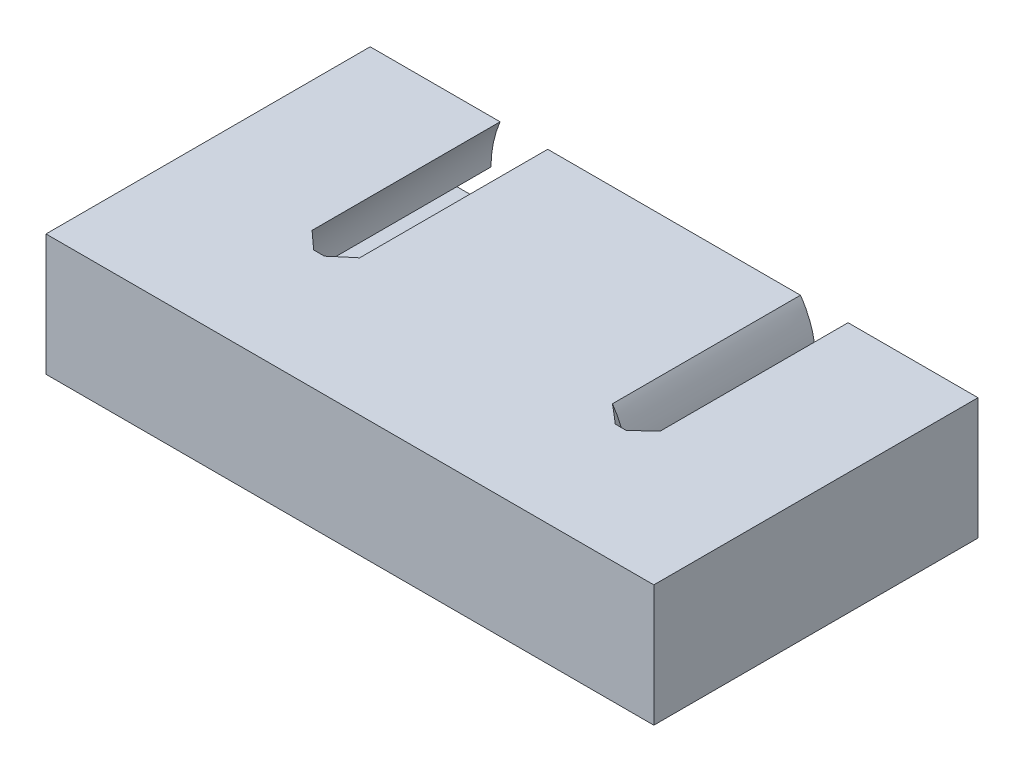
from build123d import *

# Parameters (mm, degrees)
BOSS_EXTRUDE1_DEPTH      = 7.5
BOSS_EXTRUDE1_DEPTH_BACK = 7.5
SKETCH1_W                = 75
SKETCH1_H                = 40
CUT_EXTRUDE1_DEPTH       = 5.2
CUT_EXTRUDE1_DEPTH_BACK  = 20
CHAMFER1_SIZE            = 2
SKETCH3_R                = 2
CUT_EXTRUDE2_DEPTH       = 9
CUT_EXTRUDE3_DEPTH       = 4.7
FILLET1_R                = 2


with BuildPart() as part:
    # Sketch1 → Boss-Extrude1 (new, two sides: drawn at the far end of the back side and taken through both)
    with BuildSketch(Plane(origin=(0, 0, 0), x_dir=(1, 0, 0), z_dir=(0, 1, 0)).offset(-BOSS_EXTRUDE1_DEPTH_BACK)):
        Rectangle(SKETCH1_W, SKETCH1_H)
    extrude(amount=BOSS_EXTRUDE1_DEPTH + BOSS_EXTRUDE1_DEPTH_BACK)

    # Sketch2 → Cut-Extrude1 (cut, two sides: drawn at the far end of the back side and taken through both)
    with BuildSketch(Plane.XY.offset(-CUT_EXTRUDE1_DEPTH_BACK)):
        with BuildLine():
            Line((6.87897019, 18.765118011), (-6.87897019, 18.765118011))
            add(Edge.make_bspline(
                [(-6.87897019, 18.765118011), (-9.129399026, 18.205247728), (-11.266061827, 17.3684432), (-15.104945109, 15.221192023), (-16.806572871, 13.91106443), (-19.608554315, 10.943595702), (-20.708442739, 9.286661987), (-22.197433977, 5.786794286), (-22.586183082, 3.944422776), (-22.599635329, 2.1)],
                knots=[0, 0, 0, 0, 0.25, 0.25, 0.5, 0.5, 0.75, 0.75, 1, 1, 1, 1], degree=3))
            Line((-22.599635329, 2.1), (-27.6, 2.1))
            Line((-27.6, 2.1), (-27.6, -2.1))
            Line((-27.6, -2.1), (-21.5, -2.1))
            Line((-21.5, -2.1), (-18.5, -2.1))
            Line((-18.5, -2.1), (-12.4, -2.1))
            Line((-12.4, -2.1), (-12.4, 2.1))
            Line((-12.4, 2.1), (-17.399433648, 2.1))
            add(Edge.make_bspline(
                [(-17.399433648, 2.1), (-17.381202069, 3.709535833), (-16.917608437, 5.316341272), (-15.60243407, 7.545915267), (-15.061738812, 8.259029365), (-13.79568918, 9.597737471), (-13.070365792, 10.223287356), (-10.658457879, 11.932196217), (-8.73364722, 12.845140962), (-4.538397278, 14.079281106), (-2.269643886, 14.4), (2.269643886, 14.4), (4.538397278, 14.079281106), (8.73364722, 12.845140962), (10.658457879, 11.932196217), (13.070365792, 10.223287356), (13.79568918, 9.597737471), (15.061738812, 8.259029365), (15.60243407, 7.545915267), (16.917608437, 5.316341272), (17.381202069, 3.709535833), (17.399433648, 2.1)],
                knots=[0, 0, 0, 0, 0.125, 0.125, 0.1875, 0.1875, 0.25, 0.25, 0.375, 0.375, 0.5, 0.5, 0.625, 0.625, 0.75, 0.75, 0.8125, 0.8125, 0.875, 0.875, 1, 1, 1, 1], degree=3))
            Line((17.399433648, 2.1), (12.4, 2.1))
            Line((12.4, 2.1), (12.4, -2.1))
            Line((12.4, -2.1), (18.5, -2.1))
            Line((18.5, -2.1), (21.5, -2.1))
            Line((21.5, -2.1), (27.6, -2.1))
            Line((27.6, -2.1), (27.6, 2.1))
            Line((27.6, 2.1), (22.599635329, 2.1))
            add(Edge.make_bspline(
                [(22.599635329, 2.1), (22.586183082, 3.944422776), (22.197433977, 5.786794286), (20.708442739, 9.286661987), (19.608554315, 10.943595702), (16.806572871, 13.91106443), (15.104945109, 15.221192023), (11.266061827, 17.3684432), (9.129399026, 18.205247728), (6.87897019, 18.765118011)],
                knots=[0, 0, 0, 0, 0.25, 0.25, 0.5, 0.5, 0.75, 0.75, 1, 1, 1, 1], degree=3))
        make_face()
    extrude(amount=CUT_EXTRUDE1_DEPTH + CUT_EXTRUDE1_DEPTH_BACK, mode=Mode.SUBTRACT)

    # Chamfer1
    chamfer1_edges = [part.edges().sort_by_distance(p)[0] for p in [
        (-16.904241207, 4.934871199, 5.2),
        (-22.30006804, 4.855503871, 5.2),
        (22.30006804, 4.855503871, 5.2),
        (16.904241207, 4.934871199, 5.2),
    ]]
    chamfer(chamfer1_edges, length=CHAMFER1_SIZE)

    # Sketch3 → Cut-Extrude2 (cut)
    with BuildSketch(Plane(origin=(0, 0, -20), x_dir=(-1, 0, 0), z_dir=(0, 0, -1))):
        with Locations((-20, -4.8)):
            Circle(SKETCH3_R)
        with Locations(Location((20, -4.8, 0), (0, 0, 180))):
            Circle(SKETCH3_R)
    extrude(amount=-CUT_EXTRUDE2_DEPTH, mode=Mode.SUBTRACT)

    # Sketch4 → Cut-Extrude3 (cut)
    with BuildSketch(Plane(origin=(0, -2.1, 0), x_dir=(1, 0, 0), z_dir=(0, 1, 0))):
        with BuildLine():
            Line((-22, 7.5), (-22, 10))
            Line((-22, 10), (-18, 10))
            Line((-18, 10), (-18, 7.5))
            ThreePointArc((-18, 7.5), (-20, 5.5), (-22, 7.5))
        make_face()
        with BuildLine():
            Line((18, 10), (18, 7.5))
            ThreePointArc((18, 7.5), (20, 5.5), (22, 7.5))
            Line((22, 7.5), (22, 10))
            Line((22, 10), (18, 10))
        make_face()
    extrude(amount=-CUT_EXTRUDE3_DEPTH, mode=Mode.SUBTRACT)

    # Fillet1
    fillet1_edges = [part.edges().sort_by_distance(p)[0] for p in [
        (-22, -6.8, -8.75),
        (-18, -6.8, -8.75),
        (-20, -6.8, -5.5),
        (18, -6.8, -8.75),
        (22, -6.8, -8.75),
        (20, -6.8, -5.5),
    ]]
    fillet(fillet1_edges, radius=FILLET1_R - 0.0001)  # a hair under: the kernel refuses the full size


solid = part.part
